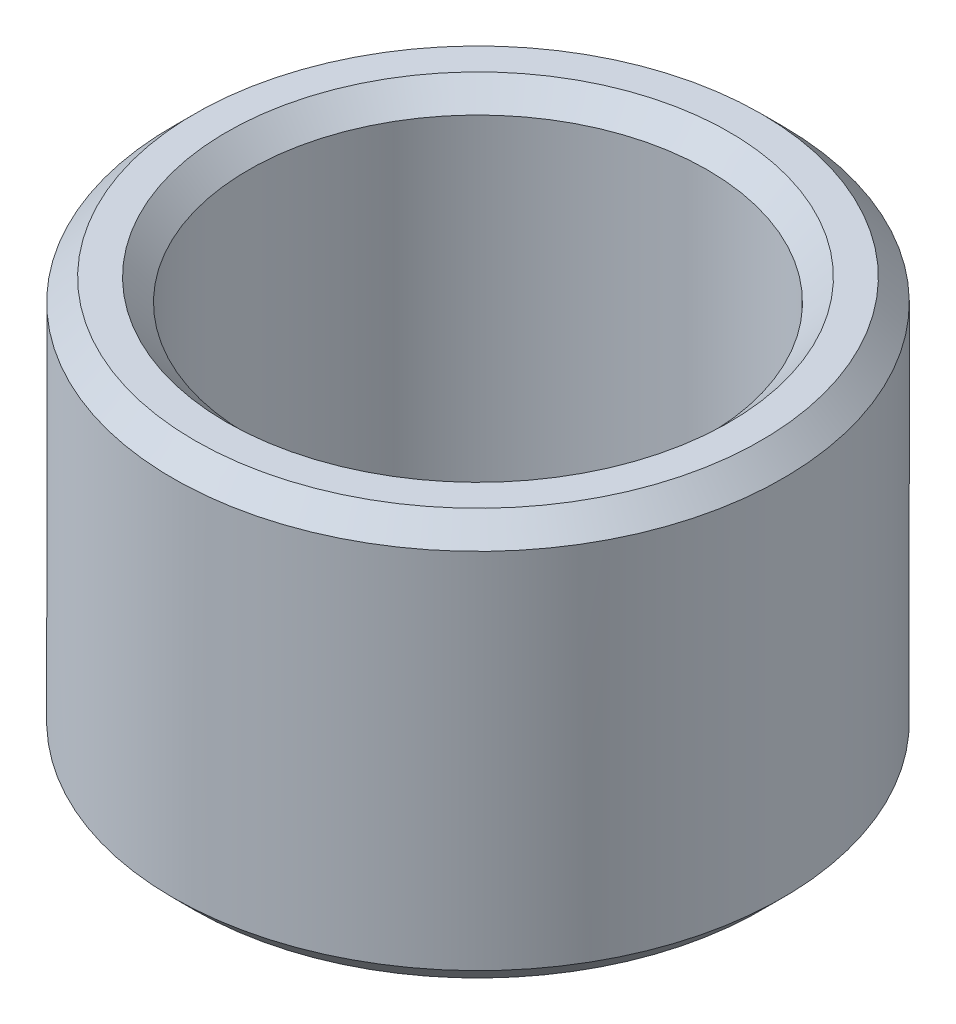
from build123d import *

# Parameters (mm, degrees)
SKETCH1_R           = 10
BOSS_EXTRUDE1_DEPTH = 13.338829637
SKETCH2_R           = 7.524567715
CUT_EXTRUDE1_DEPTH  = 20.440277161
CHAMFER1_SIZE       = 0.716964492


with BuildPart() as part:
    # Sketch1 → Boss-Extrude1 (new body)
    with BuildSketch(Plane(origin=(0, 0, 0), x_dir=(1, 0, 0), z_dir=(0, 1, 0))):
        Circle(SKETCH1_R)
    extrude(amount=BOSS_EXTRUDE1_DEPTH)

    # Sketch2 → Cut-Extrude1 (cut, through all)
    with BuildSketch(Plane(origin=(0, 0, 0), x_dir=(1, 0, 0), z_dir=(0, 1, 0))):
        Circle(SKETCH2_R)
    extrude(amount=CUT_EXTRUDE1_DEPTH, mode=Mode.SUBTRACT)

    # Chamfer1
    chamfer1_edges = [part.edges().sort_by_distance(p)[0] for p in [
        (-7.524567715, 13.338829637, 0),
        (-7.524567715, 0, 0),
        (-10, 0, 0),
        (-10, 13.338829637, 0),
    ]]
    chamfer(chamfer1_edges, length=CHAMFER1_SIZE)


solid = part.part
